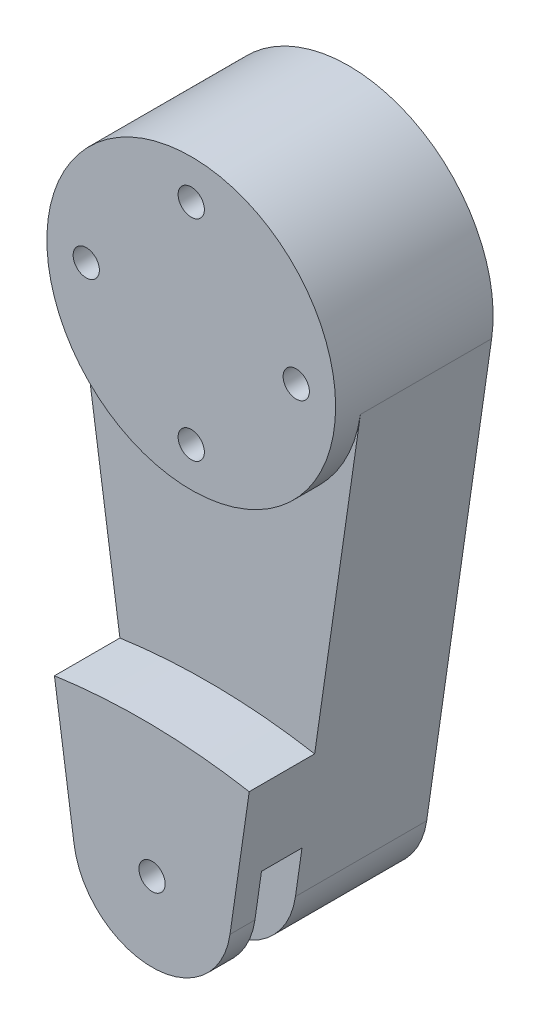
from build123d import *

# Parameters (mm, degrees)
BOSS_EXTRUDE1_DEPTH      = 100
SKETCH2_R                = 110
BOSS_EXTRUDE2_DEPTH      = 20
HOLE1_OUTLINE_R          = 10
HOLE1_DEPTH              = 120
CUT_EXTRUDE3_DEPTH       = 118
CUT_EXTRUDE3_DEPTH_BACK  = 30
SKETCH8_R                = 10
SKETCH6_R                = 10
CUT_EXTRUDE1_DEPTH       = 110
BOSS_EXTRUDE3_DEPTH      = 39.860706449
BOSS_EXTRUDE4_DEPTH      = 10
BOSS_EXTRUDE4_DEPTH_BACK = 9
SKETCH12_R               = 10
CUT_EXTRUDE4_DEPTH       = 50


# Read off the part's stored shape, not the designer's step: Hole1
with BuildPart() as part:
    # Sketch1 → Boss-Extrude1 (new body)
    with BuildSketch(Plane(origin=(0, 0, 0), x_dir=(0, 1, 0), z_dir=(0, 0, 1))):
        with BuildLine():
            Line((-358.571428571, 59.384599117), (-15.714285714, 108.871765047))
            ThreePointArc((-15.714285714, 108.871765047), (110, 0), (-15.714285714, -108.871765047))
            Line((-15.714285714, -108.871765047), (-358.571428571, -59.384599117))
            ThreePointArc((-358.571428571, -59.384599117), (-410, 0), (-358.571428571, 59.384599117))
        make_face()
    extrude(amount=BOSS_EXTRUDE1_DEPTH)

    # Sketch2 → Boss-Extrude2 (add)
    with BuildSketch(Plane.XY.offset(100)):
        with Locations(Location((0, 0, 0), (0, 0, 188.213210702))):
            Circle(SKETCH2_R)
    extrude(amount=BOSS_EXTRUDE2_DEPTH)

    # Hole1 outline → Hole1 (cut)
    with BuildSketch(Plane.XY):
        with Locations((-80, 0)):
            Circle(HOLE1_OUTLINE_R)
        with Locations((0, -80)):
            Circle(HOLE1_OUTLINE_R)
        with Locations((0, 80)):
            Circle(HOLE1_OUTLINE_R)
        with Locations((80, 0)):
            Circle(HOLE1_OUTLINE_R)
    extrude(amount=HOLE1_DEPTH, mode=Mode.SUBTRACT)

    # Sketch8 → Cut-Extrude3 (cut, two sides: drawn at the far end of the back side and taken through both)
    with BuildSketch(Plane.XY.offset(100).offset(-CUT_EXTRUDE3_DEPTH_BACK)):
        with Locations(Location((0, -350, 0), (0, 0, 180))):
            Circle(SKETCH8_R)
    extrude(amount=CUT_EXTRUDE3_DEPTH + CUT_EXTRUDE3_DEPTH_BACK, mode=Mode.SUBTRACT)

    # Sketch6 → Cut-Extrude1 (cut)
    with BuildSketch(Plane(origin=(0, 0, 0), x_dir=(0, 1, 0), z_dir=(0, 0, 1))):
        with Locations(Location((0, 0, 0), (0, 0, 270))):
            Circle(SKETCH6_R)
    extrude(amount=CUT_EXTRUDE1_DEPTH, mode=Mode.SUBTRACT)

    # Sketch9 → Boss-Extrude3 (add)
    with BuildSketch(Plane.XY.offset(100)):
        with BuildLine():
            Line((-64.374555015, -324), (-36.774899392, -302.591068619))
            ThreePointArc((-36.774899392, -302.591068619), (0, -290), (36.774899392, -302.591068619))
            Line((36.774899392, -302.591068619), (64.374555015, -324))
            Line((64.374555015, -324), (74.034146431, -257.076387544))
            ThreePointArc((74.034146431, -257.076387544), (-0.07319601, -250.054292708), (-74.359735508, -254.820640253))
            Line((-74.359735508, -254.820640253), (-64.374555015, -324))
        make_face()
    extrude(amount=BOSS_EXTRUDE3_DEPTH)

    # Sketch10 → Boss-Extrude4 (add, two sides: drawn at the far end of the back side and taken through both)
    with BuildSketch(Plane.XY.offset(139.860706449).offset(-BOSS_EXTRUDE4_DEPTH_BACK)):
        with BuildLine():
            Line((-59.384599117, -358.571428571), (-74.359735508, -254.820640253))
            ThreePointArc((-74.359735508, -254.820640253), (-0.07319601, -250.054292708), (74.034146431, -257.076387544))
            Line((74.034146431, -257.076387544), (59.384599117, -358.571428571))
            ThreePointArc((59.384599117, -358.571428571), (0, -410), (-59.384599117, -358.571428571))
        make_face()
    extrude(amount=BOSS_EXTRUDE4_DEPTH + BOSS_EXTRUDE4_DEPTH_BACK)

    # Sketch12 → Cut-Extrude4 (cut)
    with BuildSketch(Plane.XY.offset(149.860706449)):
        with Locations(Location((0, -350, 0), (0, 0, 180))):
            Circle(SKETCH12_R)
    extrude(amount=-CUT_EXTRUDE4_DEPTH, mode=Mode.SUBTRACT)


solid = part.part
